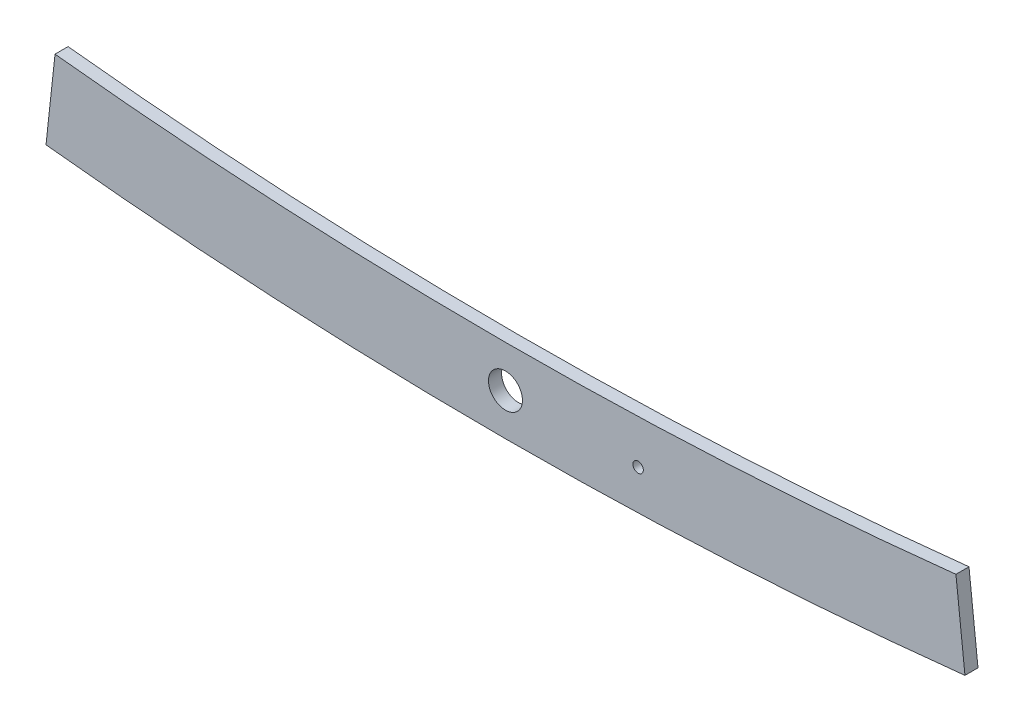
from build123d import *

# Parameters (mm, degrees)
BOSS_EXTRUDE1_DEPTH = 1.25
SKETCH2_R           = 3.25
CUT_EXTRUDE1_DEPTH  = 10
SKETCH3_R           = 1
CUT_EXTRUDE2_DEPTH  = 10


with BuildPart() as part:
    # Sketch1 → Boss-Extrude1 (new, symmetric)
    with BuildSketch(Plane.XY):
        with BuildLine():
            Line((88, 4.758975396), (86.274509804, 20.665662153))
            ThreePointArc((86.274509804, 20.665662153), (0, 16), (-86.274509804, 20.665662153))
            Line((-86.274509804, 20.665662153), (-88, 4.758975396))
            ThreePointArc((-88, 4.758975396), (0, 0), (88, 4.758975396))
        make_face()
    extrude(amount=BOSS_EXTRUDE1_DEPTH, both=True)

    # Sketch2 → Cut-Extrude1 (cut, symmetric)
    with BuildSketch(Plane.XY):
        with Locations((0, 8)):
            Circle(SKETCH2_R)
    extrude(amount=CUT_EXTRUDE1_DEPTH, both=True, mode=Mode.SUBTRACT)

    # Sketch3 → Cut-Extrude2 (cut, symmetric)
    with BuildSketch(Plane.XY):
        with Locations((25.4, 8)):
            Circle(SKETCH3_R)
    extrude(amount=CUT_EXTRUDE2_DEPTH, both=True, mode=Mode.SUBTRACT)


solid = part.part
